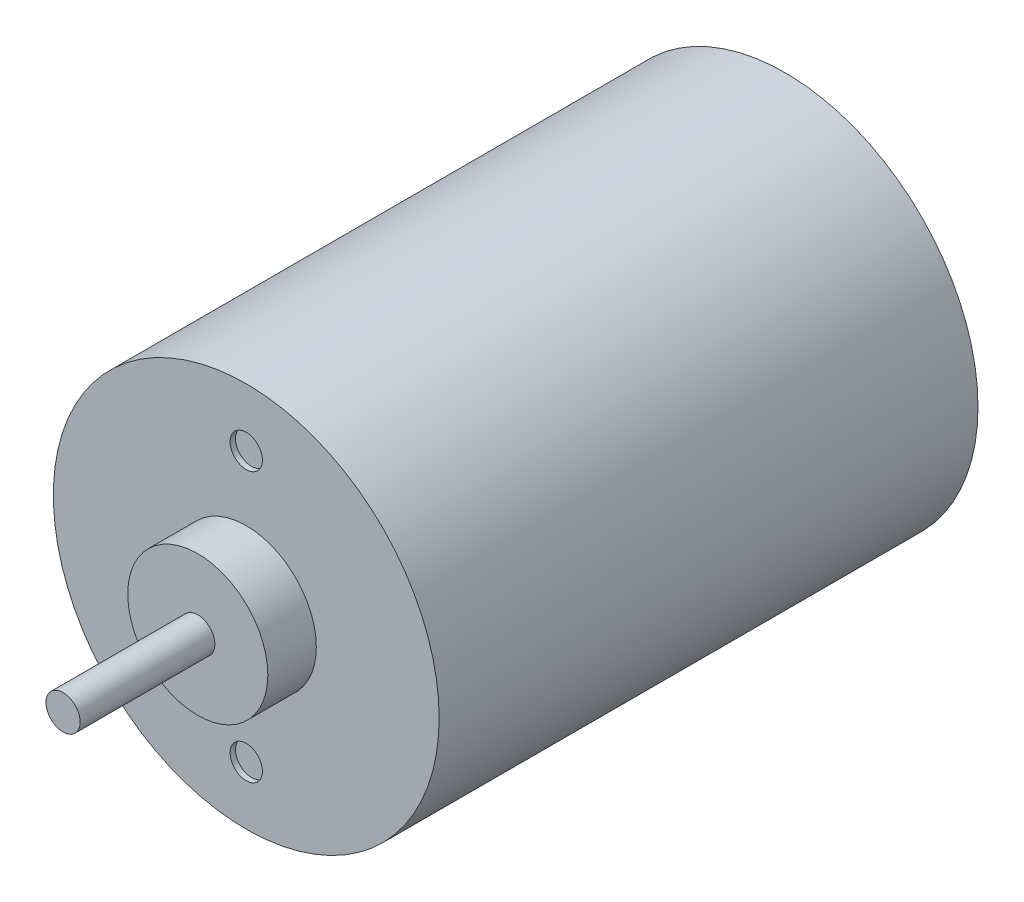
from build123d import *

# Parameters (mm, degrees)
SKETCH_2_R          = 17.9
EXTRUDE_1_DEPTH     = 50
SKETCH_3_R          = 6.5
EXTRUDE_2_DEPTH     = 4.5
SKETCH_4_R          = 1.585
EXTRUDE_5_DEPTH     = 12.5
SKETCH_5_R          = 1.5
CUT_EXTRUDE_1_DEPTH = 0.5


with BuildPart() as part:
    # ｽｹｯﾁ2 → ﾎﾞｽ - 押し出し1 (new body)
    with BuildSketch(Plane.XY):
        Circle(SKETCH_2_R)
    extrude(amount=EXTRUDE_1_DEPTH)

    # ｽｹｯﾁ3 → ﾎﾞｽ - 押し出し2 (add)
    with BuildSketch(Plane.XY.offset(50)):
        Circle(SKETCH_3_R)
    extrude(amount=EXTRUDE_2_DEPTH)

    # ｽｹｯﾁ4 → ﾎﾞｽ - 押し出し5 (add)
    with BuildSketch(Plane.XY.offset(54.5)):
        Circle(SKETCH_4_R)
    extrude(amount=EXTRUDE_5_DEPTH)

    # ｽｹｯﾁ5 → ｶｯﾄ - 押し出し1 (cut)
    with BuildSketch(Plane.XY.offset(50)):
        with Locations((0, 12.5)):
            Circle(SKETCH_5_R)
        with Locations((0, -12.5)):
            Circle(SKETCH_5_R)
    extrude(amount=-CUT_EXTRUDE_1_DEPTH, mode=Mode.SUBTRACT)


solid = part.part
